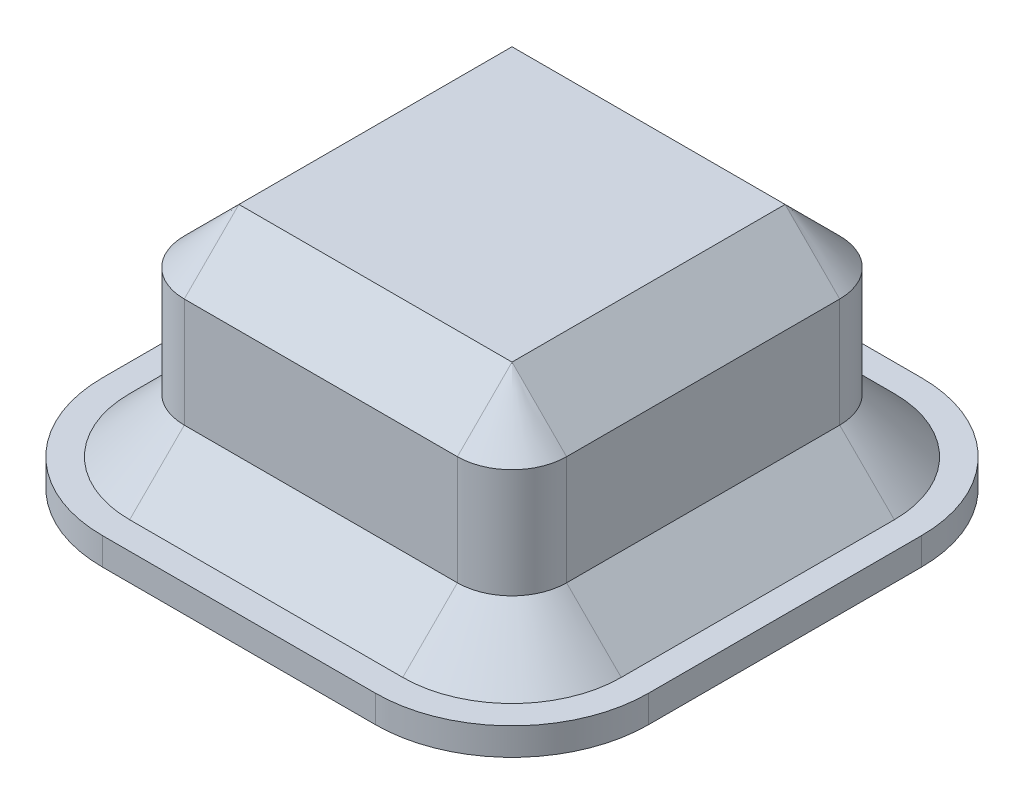
from build123d import *

# Parameters (mm, degrees)
SKETCH1_W           = 20
SKETCH1_H           = 20
BOSS_EXTRUDE1_DEPTH = 1
FILLET2_R           = 5
BOSS_EXTRUDE3_DEPTH = 8
CHAMFER1_SIZE       = 2
CHAMFER3_SIZE       = 2


with BuildPart() as part:
    # Sketch1 → Boss-Extrude1 (new body)
    with BuildSketch(Plane(origin=(0, 0, 0), x_dir=(1, 0, 0), z_dir=(0, 1, 0))):
        Rectangle(SKETCH1_W, SKETCH1_H)
    extrude(amount=BOSS_EXTRUDE1_DEPTH)

    # Fillet2
    fillet2_edges = [part.edges().sort_by_distance(p)[0] for p in [
        (10, 0.5, 10),
        (-10, 0.5, 10),
        (-10, 0.5, -10),
        (10, 0.5, -10),
    ]]
    fillet(fillet2_edges, radius=FILLET2_R)

    # Sketch3 → Boss-Extrude3 (add)
    with BuildSketch(Plane(origin=(0, 1, 0), x_dir=(1, 0, 0), z_dir=(0, 1, 0))):
        with BuildLine():
            Line((-7, 5), (-7, -5))
            ThreePointArc((-7, -5), (-6.414213562, -6.414213562), (-5, -7))
            Line((-5, -7), (5, -7))
            ThreePointArc((5, -7), (6.414213562, -6.414213562), (7, -5))
            Line((7, -5), (7, 5))
            ThreePointArc((7, 5), (6.414213562, 6.414213562), (5, 7))
            Line((5, 7), (-5, 7))
            ThreePointArc((-5, 7), (-6.414213562, 6.414213562), (-7, 5))
        make_face()
    extrude(amount=BOSS_EXTRUDE3_DEPTH)

    # Chamfer1
    chamfer1_edges = [part.edges().sort_by_distance(p)[0] for p in [
        (-6.414213562, 1, -6.414213562),
        (-7, 1, 0),
        (-6.414213562, 1, 6.414213562),
        (0, 1, 7),
        (6.414213562, 1, 6.414213562),
        (7, 1, 0),
        (6.414213562, 1, -6.414213562),
        (0, 1, -7),
    ]]
    chamfer(chamfer1_edges, length=CHAMFER1_SIZE)

    # Chamfer3
    chamfer3_edges = [part.edges().sort_by_distance(p)[0] for p in [
        (-6.414213562, 9, -6.414213562),
        (-7, 9, 0),
        (-6.414213562, 9, 6.414213562),
        (0, 9, 7),
        (6.414213562, 9, 6.414213562),
        (7, 9, 0),
        (6.414213562, 9, -6.414213562),
        (0, 9, -7),
    ]]
    chamfer(chamfer3_edges, length=CHAMFER3_SIZE - 0.0001)  # a hair under: the kernel refuses the full size


solid = part.part
